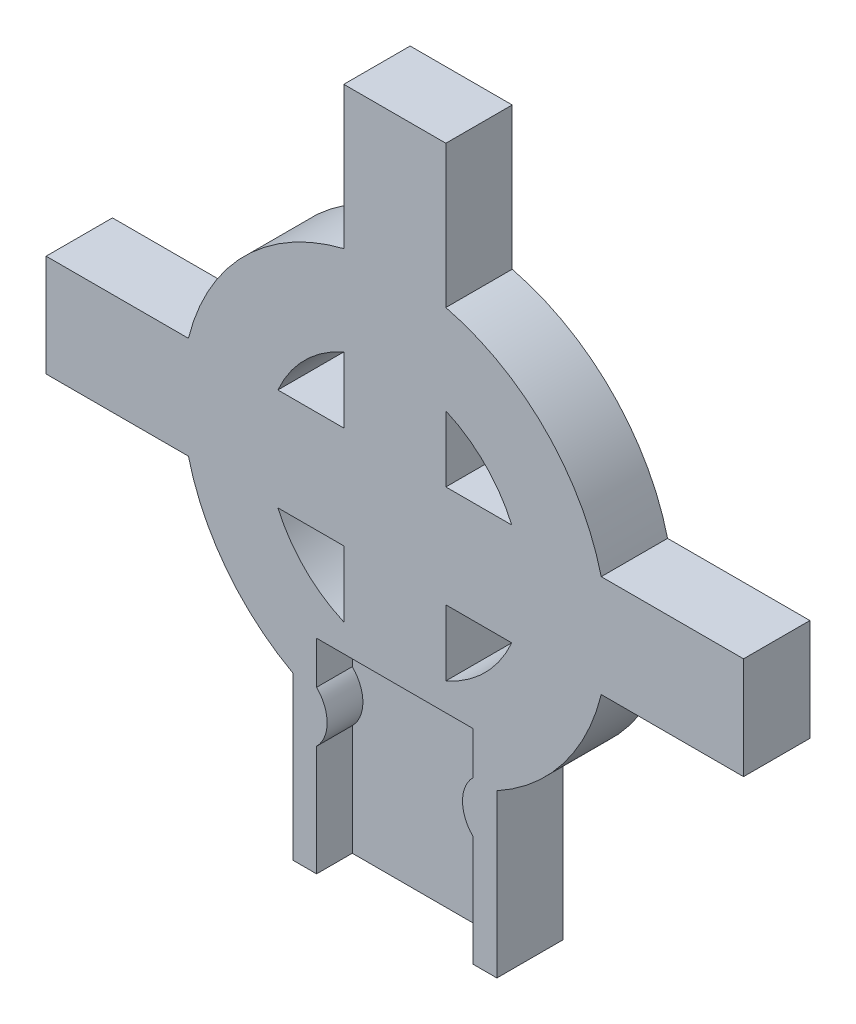
from build123d import *

# Parameters (mm, degrees)
SALIENTE_EXTRUIR1_DEPTH = 3.9
CORTAR_EXTRUIR1_DEPTH   = 2.1


with BuildPart() as part:
    # Croquis1 → Saliente-Extruir1 (new body)
    with BuildSketch(Plane.XY):
        with BuildLine():
            Line((0, 0), (-12, 0))
            Line((-12, 0), (-12, 9.5341439))
            ThreePointArc((-12, 9.5341439), (-15.903544777, 12.873087069), (-18.1346611, 17.5))
            Line((-18.1346611, 17.5), (-26.5, 17.5))
            Line((-26.5, 17.5), (-26.5, 23.5))
            Line((-26.5, 23.5), (-18.1346611, 23.5))
            ThreePointArc((-18.1346611, 23.5), (-14.838834765, 29.338834765), (-9, 32.6346611))
            Line((-9, 32.6346611), (-9, 41))
            Line((-9, 41), (-3, 41))
            Line((-3, 41), (-3, 32.6346611))
            ThreePointArc((-3, 32.6346611), (2.838834765, 29.338834765), (6.1346611, 23.5))
            Line((6.1346611, 23.5), (14.5, 23.5))
            Line((14.5, 23.5), (14.5, 17.5))
            Line((14.5, 17.5), (6.1346611, 17.5))
            ThreePointArc((6.1346611, 17.5), (3.903544777, 12.873087069), (0, 9.5341439))
            Line((0, 9.5341439), (0, 0))
        make_face()
        with BuildLine():
            Line((-9, 23.5), (-9, 27.373863542))
            ThreePointArc((-9, 27.373863542), (-11.303300859, 25.803300859), (-12.873863542, 23.5))
            Line((-12.873863542, 23.5), (-9, 23.5))
        make_face(mode=Mode.SUBTRACT)
        with BuildLine():
            Line((-3, 23.5), (-3, 27.373863542))
            ThreePointArc((-3, 27.373863542), (-0.696699141, 25.803300859), (0.873863542, 23.5))
            Line((0.873863542, 23.5), (-3, 23.5))
        make_face(mode=Mode.SUBTRACT)
        with BuildLine():
            Line((-9, 17.5), (-9, 13.626136458))
            ThreePointArc((-9, 13.626136458), (-11.303300859, 15.196699141), (-12.873863542, 17.5))
            Line((-12.873863542, 17.5), (-9, 17.5))
        make_face(mode=Mode.SUBTRACT)
        with BuildLine():
            Line((-3, 17.5), (-3, 13.626136458))
            ThreePointArc((-3, 13.626136458), (-0.696699141, 15.196699141), (0.873863542, 17.5))
            Line((0.873863542, 17.5), (-3, 17.5))
        make_face(mode=Mode.SUBTRACT)
    extrude(amount=SALIENTE_EXTRUIR1_DEPTH)

    # Croquis2 → Cortar-Extruir1 (cut)
    with BuildSketch(Plane.XY.offset(3.9)):
        with BuildLine():
            Line((-10.6, 0), (-1.4, 0))
            Line((-1.4, 0), (-1.4, 6.5))
            ThreePointArc((-1.4, 6.5), (-2.021320344, 8), (-1.4, 9.5))
            Line((-1.4, 9.5), (-1.4, 12))
            Line((-1.4, 12), (-10.6, 12))
            Line((-10.6, 12), (-10.6, 9.5))
            ThreePointArc((-10.6, 9.5), (-9.978679656, 8), (-10.6, 6.5))
            Line((-10.6, 6.5), (-10.6, 0))
        make_face()
    extrude(amount=-CORTAR_EXTRUIR1_DEPTH, mode=Mode.SUBTRACT)


solid = part.part
